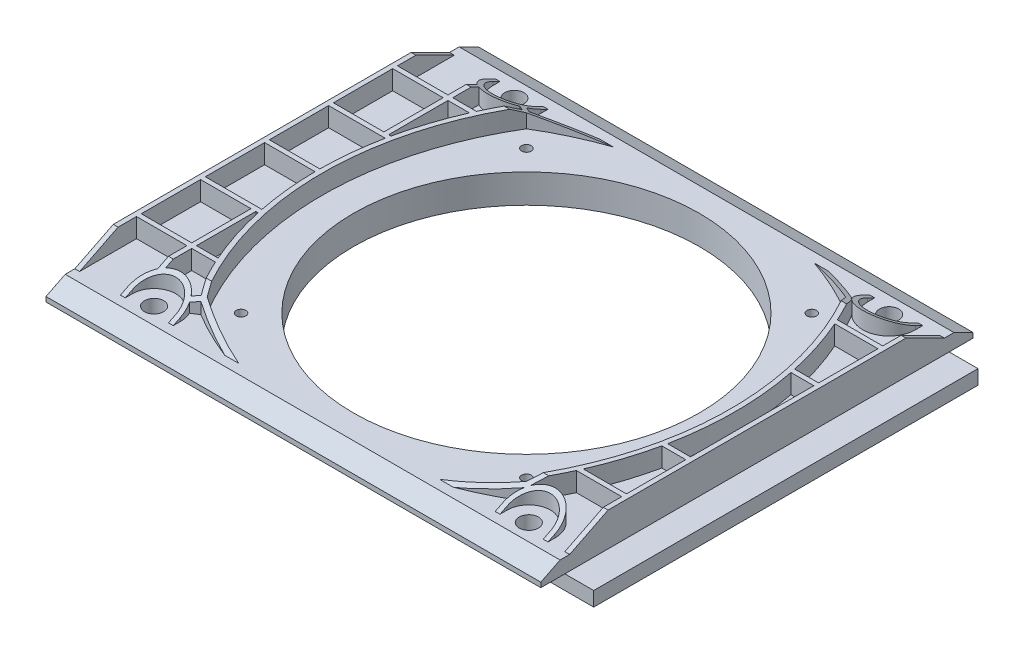
from build123d import *

# Parameters (mm, degrees)
SKETCH1_W               = 103
SKETCH1_H               = 90
BOSS_EXTRUDE1_DEPTH     = 3
SKETCH10_W              = 102
SKETCH10_H              = 80
BOSS_EXTRUDE4_DEPTH     = 3
CUT_EXTRUDE1_REACH      = 75.262
SKETCH2_R               = 36
CUT_EXTRUDE2_REACH      = 75.262
SKETCH3_R               = 2
CUT_EXTRUDE3_REACH      = 75.262
SKETCH5_R               = 1
EXTRUDE_THIN1_OUTLINE_W = 10.5
EXTRUDE_THIN1_OUTLINE_H = 12.333333334
EXTRUDE_THIN1_DEPTH     = 4
CUT_EXTRUDE5_DEPTH      = 113.618826135
SKETCH11_W              = 61
SKETCH11_H              = 3
SKETCH11_W_2            = 94.502012864
SKETCH11_H_2            = 69
CUT_EXTRUDE6_DEPTH      = 3
BOSS_EXTRUDE5_DEPTH     = 69
SKETCH13_R              = 37.5
SKETCH13_R_2            = 36
BOSS_EXTRUDE6_DEPTH     = 3
EXTRUDE_THIN11_DEPTH    = 3
EXTRUDE_THIN11_2_DEPTH  = 3
EXTRUDE_THIN11_3_DEPTH  = 3
EXTRUDE_THIN11_4_DEPTH  = 3
SKETCH14_W              = 11
SKETCH14_H              = 3
EXTRUDE_THIN11_5_DEPTH  = 3
SKETCH14_W_2            = 12
EXTRUDE_THIN11_6_DEPTH  = 3
SKETCH15_R              = 1
CUT_EXTRUDE7_DEPTH      = 74.261517866


# Read off the part's stored shape, not the designer's step: Extrude-Thin1
with BuildPart() as part:
    # Sketch1 → Boss-Extrude1 (new body)
    with BuildSketch(Plane(origin=(0, 0, 0), x_dir=(1, 0, 0), z_dir=(0, 1, 0))):
        Rectangle(SKETCH1_W, SKETCH1_H)
    extrude(amount=BOSS_EXTRUDE1_DEPTH)

    # Sketch10 → Boss-Extrude4 (add)
    with BuildSketch(Plane(origin=(0, 0, 0), x_dir=(-1, 0, 0), z_dir=(0, -1, 0))):
        with Locations((-6.5, 0)):
            Rectangle(SKETCH10_W, SKETCH10_H)
    extrude(amount=BOSS_EXTRUDE4_DEPTH)

    # Sketch2 → Cut-Extrude1 (cut, up to next)
    with BuildSketch(Plane(origin=(0, 3, 0), x_dir=(1, 0, 0), z_dir=(0, 1, 0)), mode=Mode.PRIVATE) as cut_extrude1_sk1:
        with Locations(Location((3.5, 0, 0), (0, 0, 270))):
            Circle(SKETCH2_R)
    cut_extrude1_tool1 = extrude(cut_extrude1_sk1.sketch, amount=-CUT_EXTRUDE1_REACH, mode=Mode.PRIVATE) & part.part
    add(cut_extrude1_tool1.solids().sort_by_distance((3.5, 3, 0))[0], mode=Mode.SUBTRACT)

    # Sketch3 → Cut-Extrude2 (cut, up to next)
    with BuildSketch(Plane(origin=(0, 3, 0), x_dir=(1, 0, 0), z_dir=(0, 1, 0)), mode=Mode.PRIVATE) as cut_extrude2_sk1:
        with Locations(Location((-36.5, 37.5, 0), (0, 0, 270))):
            Circle(SKETCH3_R)
    cut_extrude2_tool1 = extrude(cut_extrude2_sk1.sketch, amount=-CUT_EXTRUDE2_REACH, mode=Mode.PRIVATE) & part.part
    # Sketch3 → Cut-Extrude2 (cut, up to next)
    with BuildSketch(Plane(origin=(0, 3, 0), x_dir=(1, 0, 0), z_dir=(0, 1, 0)), mode=Mode.PRIVATE) as cut_extrude2_sk2:
        with Locations(Location((41.5, 37.5, 0), (0, 0, 270))):
            Circle(SKETCH3_R)
    cut_extrude2_tool2 = extrude(cut_extrude2_sk2.sketch, amount=-CUT_EXTRUDE2_REACH, mode=Mode.PRIVATE) & part.part
    # Sketch3 → Cut-Extrude2 (cut, up to next)
    with BuildSketch(Plane(origin=(0, 3, 0), x_dir=(1, 0, 0), z_dir=(0, 1, 0)), mode=Mode.PRIVATE) as cut_extrude2_sk3:
        with Locations(Location((41.5, -37.5, 0), (0, 0, 270))):
            Circle(SKETCH3_R)
    cut_extrude2_tool3 = extrude(cut_extrude2_sk3.sketch, amount=-CUT_EXTRUDE2_REACH, mode=Mode.PRIVATE) & part.part
    # Sketch3 → Cut-Extrude2 (cut, up to next)
    with BuildSketch(Plane(origin=(0, 3, 0), x_dir=(1, 0, 0), z_dir=(0, 1, 0)), mode=Mode.PRIVATE) as cut_extrude2_sk4:
        with Locations(Location((-36.5, -37.5, 0), (0, 0, 270))):
            Circle(SKETCH3_R)
    cut_extrude2_tool4 = extrude(cut_extrude2_sk4.sketch, amount=-CUT_EXTRUDE2_REACH, mode=Mode.PRIVATE) & part.part
    add(cut_extrude2_tool1.solids().sort_by_distance((-36.5, 3, -37.5))[0], mode=Mode.SUBTRACT)
    add(cut_extrude2_tool2.solids().sort_by_distance((41.5, 3, -37.5))[0], mode=Mode.SUBTRACT)
    add(cut_extrude2_tool3.solids().sort_by_distance((41.5, 3, 37.5))[0], mode=Mode.SUBTRACT)
    add(cut_extrude2_tool4.solids().sort_by_distance((-36.5, 3, 37.5))[0], mode=Mode.SUBTRACT)

    # Sketch5 → Cut-Extrude3 (cut, up to next)
    with BuildSketch(Plane(origin=(0, 3, 0), x_dir=(1, 0, 0), z_dir=(0, 1, 0)), mode=Mode.PRIVATE) as cut_extrude3_sk1:
        with Locations(Location((-26.2, 29.7, 0), (0, 0, 270))):
            Circle(SKETCH5_R)
    cut_extrude3_tool1 = extrude(cut_extrude3_sk1.sketch, amount=-CUT_EXTRUDE3_REACH, mode=Mode.PRIVATE) & part.part
    # Sketch5 → Cut-Extrude3 (cut, up to next)
    with BuildSketch(Plane(origin=(0, 3, 0), x_dir=(1, 0, 0), z_dir=(0, 1, 0)), mode=Mode.PRIVATE) as cut_extrude3_sk2:
        with Locations(Location((33.2, 29.7, 0), (0, 0, 270))):
            Circle(SKETCH5_R)
    cut_extrude3_tool2 = extrude(cut_extrude3_sk2.sketch, amount=-CUT_EXTRUDE3_REACH, mode=Mode.PRIVATE) & part.part
    # Sketch5 → Cut-Extrude3 (cut, up to next)
    with BuildSketch(Plane(origin=(0, 3, 0), x_dir=(1, 0, 0), z_dir=(0, 1, 0)), mode=Mode.PRIVATE) as cut_extrude3_sk3:
        with Locations(Location((33.2, -29.7, 0), (0, 0, 270))):
            Circle(SKETCH5_R)
    cut_extrude3_tool3 = extrude(cut_extrude3_sk3.sketch, amount=-CUT_EXTRUDE3_REACH, mode=Mode.PRIVATE) & part.part
    # Sketch5 → Cut-Extrude3 (cut, up to next)
    with BuildSketch(Plane(origin=(0, 3, 0), x_dir=(1, 0, 0), z_dir=(0, 1, 0)), mode=Mode.PRIVATE) as cut_extrude3_sk4:
        with Locations(Location((-26.2, -29.7, 0), (0, 0, 270))):
            Circle(SKETCH5_R)
    cut_extrude3_tool4 = extrude(cut_extrude3_sk4.sketch, amount=-CUT_EXTRUDE3_REACH, mode=Mode.PRIVATE) & part.part
    add(cut_extrude3_tool1.solids().sort_by_distance((-26.2, 3, -29.7))[0], mode=Mode.SUBTRACT)
    add(cut_extrude3_tool2.solids().sort_by_distance((33.2, 3, -29.7))[0], mode=Mode.SUBTRACT)
    add(cut_extrude3_tool3.solids().sort_by_distance((33.2, 3, 29.7))[0], mode=Mode.SUBTRACT)
    add(cut_extrude3_tool4.solids().sort_by_distance((-26.2, 3, 29.7))[0], mode=Mode.SUBTRACT)

    # Extrude-Thin1 outline → Extrude-Thin1 (add)
    with BuildSketch(Plane(origin=(0, 3, 0), x_dir=(1, 0, 0), z_dir=(0, 1, 0))):
        with BuildLine():
            Line((-51.5, 40.5), (-51.5, -40.5))
            Line((-51.5, -40.5), (-41, -40.5))
            Line((-41, -40.5), (-41, -37.5))
            ThreePointArc((-41, -37.5), (-36.5, -33), (-32, -37.5))
            Line((-32, -37.5), (-32, -40.5))
            Line((-32, -40.5), (37, -40.5))
            Line((37, -40.5), (37, -37.5))
            ThreePointArc((37, -37.5), (41.5, -33), (46, -37.5))
            Line((46, -37.5), (46, -40.5))
            Line((46, -40.5), (51.5, -40.5))
            Line((51.5, -40.5), (51.5, 40.5))
            Line((51.5, 40.5), (46, 40.5))
            Line((46, 40.5), (46, 37.5))
            ThreePointArc((46, 37.5), (41.5, 33), (37, 37.5))
            Line((37, 37.5), (37, 40.5))
            Line((37, 40.5), (-32, 40.5))
            Line((-32, 40.5), (-32, 37.5))
            ThreePointArc((-32, 37.5), (-36.5, 33), (-41, 37.5))
            Line((-41, 37.5), (-41, 40.5))
            Line((-41, 40.5), (-51.5, 40.5))
        make_face()
        with BuildLine():
            Line((-50.5, -27.166666667), (-40, -27.166666667))
            Line((-40, -27.166666667), (-40, -33.257359313))
            ThreePointArc((-40, -33.257359313), (-41.474937186, -35.15479212), (-42, -37.5))
            Line((-42, -37.5), (-42, -39.5))
            Line((-42, -39.5), (-50.5, -39.5))
            Line((-50.5, -39.5), (-50.5, -27.166666667))
        make_face(mode=Mode.SUBTRACT)
        with BuildLine():
            ThreePointArc((-34.064021992, -27.166666667), (-32.503173696, -30.337907716), (-30.772596167, -33.419809501))
            Line((-30.772596167, -33.419809501), (-32.084767986, -34.220407607))
            ThreePointArc((-32.084767986, -34.220407607), (-35.245953727, -32.14487461), (-39, -32.601020514))
            Line((-39, -32.601020514), (-39, -27.166666667))
            Line((-39, -27.166666667), (-34.064021992, -27.166666667))
        make_face(mode=Mode.SUBTRACT)
        with BuildLine():
            ThreePointArc((-30.086481626, -34.172624522), (-24.656391553, -37.099728456), (-18.973741453, -39.5))
            Line((-18.973741453, -39.5), (-31, -39.5))
            Line((-31, -39.5), (-31, -37.5))
            ThreePointArc((-31, -37.5), (-31.142836404, -36.254689515), (-31.56392662, -35.074061092))
            Line((-31.56392662, -35.074061092), (-30.086481626, -34.172624522))
        make_face(mode=Mode.SUBTRACT)
        with Locations((-45.25, -20)):
            Rectangle(EXTRUDE_THIN1_OUTLINE_W, EXTRUDE_THIN1_OUTLINE_H, mode=Mode.SUBTRACT)
        with BuildLine():
            ThreePointArc((-38.514061642, -13.833333333), (-36.82108914, -20.099814555), (-34.512789281, -26.166666667))
            Line((-34.512789281, -26.166666667), (-39, -26.166666667))
            Line((-39, -26.166666667), (-39, -13.833333333))
            Line((-39, -13.833333333), (-38.514061642, -13.833333333))
        make_face(mode=Mode.SUBTRACT)
        with BuildLine():
            ThreePointArc((-39.99808084, -0.5), (-39.65478707, -6.697071885), (-38.723204539, -12.833333333))
            Line((-38.723204539, -12.833333333), (-50.5, -12.833333333))
            Line((-50.5, -12.833333333), (-50.5, -0.5))
            Line((-50.5, -0.5), (-39.99808084, -0.5))
        make_face(mode=Mode.SUBTRACT)
        with BuildLine():
            ThreePointArc((25.973741453, -39.5), (31.689836851, -37.083683283), (37.150025464, -34.134331933))
            ThreePointArc((37.150025464, -34.134331933), (36.295441424, -35.721638387), (36, -37.5))
            Line((36, -37.5), (36, -39.5))
            Line((36, -39.5), (25.973741453, -39.5))
        make_face(mode=Mode.SUBTRACT)
        with BuildLine():
            Line((41.064021992, -27.166666667), (50.5, -27.166666667))
            Line((50.5, -27.166666667), (50.5, -39.5))
            Line((50.5, -39.5), (47, -39.5))
            Line((47, -39.5), (47, -37.5))
            ThreePointArc((47, -37.5), (43.677337851, -32.449336689), (37.723927315, -33.501090764))
            ThreePointArc((37.723927315, -33.501090764), (39.481094932, -30.37981659), (41.064021992, -27.166666667))
        make_face(mode=Mode.SUBTRACT)
        with BuildLine():
            Line((50.5, -13.833333333), (50.5, -26.166666667))
            Line((50.5, -26.166666667), (41.512789281, -26.166666667))
            ThreePointArc((41.512789281, -26.166666667), (43.82108914, -20.099814555), (45.514061642, -13.833333333))
            Line((45.514061642, -13.833333333), (50.5, -13.833333333))
        make_face(mode=Mode.SUBTRACT)
        with BuildLine():
            ThreePointArc((-38.723204539, 12.833333333), (-39.65478707, 6.697071885), (-39.99808084, 0.5))
            Line((-39.99808084, 0.5), (-50.5, 0.5))
            Line((-50.5, 0.5), (-50.5, 12.833333333))
            Line((-50.5, 12.833333333), (-38.723204539, 12.833333333))
        make_face(mode=Mode.SUBTRACT)
        with Locations((-45.25, 20)):
            Rectangle(EXTRUDE_THIN1_OUTLINE_W, EXTRUDE_THIN1_OUTLINE_H, mode=Mode.SUBTRACT)
        with BuildLine():
            ThreePointArc((-34.512789281, 26.166666667), (-36.82108914, 20.099814555), (-38.514061642, 13.833333333))
            Line((-38.514061642, 13.833333333), (-39, 13.833333333))
            Line((-39, 13.833333333), (-39, 26.166666667))
            Line((-39, 26.166666667), (-34.512789281, 26.166666667))
        make_face(mode=Mode.SUBTRACT)
        with BuildLine():
            Line((-40, 33.257359313), (-40, 27.166666667))
            Line((-40, 27.166666667), (-50.5, 27.166666667))
            Line((-50.5, 27.166666667), (-50.5, 39.5))
            Line((-50.5, 39.5), (-42, 39.5))
            Line((-42, 39.5), (-42, 37.5))
            ThreePointArc((-42, 37.5), (-41.474937186, 35.15479212), (-40, 33.257359313))
        make_face(mode=Mode.SUBTRACT)
        with BuildLine():
            ThreePointArc((-30.772596167, 33.419809501), (-32.503173696, 30.337907716), (-34.064021992, 27.166666667))
            Line((-34.064021992, 27.166666667), (-39, 27.166666667))
            Line((-39, 27.166666667), (-39, 32.601020514))
            ThreePointArc((-39, 32.601020514), (-35.245953727, 32.14487461), (-32.084767986, 34.220407607))
            Line((-32.084767986, 34.220407607), (-30.772596167, 33.419809501))
        make_face(mode=Mode.SUBTRACT)
        with BuildLine():
            ThreePointArc((-31.56392662, 35.074061092), (-31.142836404, 36.254689515), (-31, 37.5))
            Line((-31, 37.5), (-31, 39.5))
            Line((-31, 39.5), (-18.973741453, 39.5))
            ThreePointArc((-18.973741453, 39.5), (-24.656391553, 37.099728456), (-30.086481626, 34.172624522))
            Line((-30.086481626, 34.172624522), (-31.56392662, 35.074061092))
        make_face(mode=Mode.SUBTRACT)
        with BuildLine():
            Line((22.885607836, -39.5), (-15.885607836, -39.5))
            ThreePointArc((-15.885607836, -39.5), (-22.991137916, -36.773065937), (-29.72359575, -33.22359575))
            ThreePointArc((-29.72359575, -33.22359575), (-39, 0), (-29.72359575, 33.22359575))
            ThreePointArc((-29.72359575, 33.22359575), (-22.991137916, 36.773065937), (-15.885607836, 39.5))
            Line((-15.885607836, 39.5), (22.885607836, 39.5))
            ThreePointArc((22.885607836, 39.5), (29.991137916, 36.773065937), (36.72359575, 33.22359575))
            ThreePointArc((36.72359575, 33.22359575), (46, 0), (36.72359575, -33.22359575))
            ThreePointArc((36.72359575, -33.22359575), (29.991137916, -36.773065937), (22.885607836, -39.5))
        make_face(mode=Mode.SUBTRACT)
        with BuildLine():
            Line((50.5, 12.833333333), (50.5, -12.833333333))
            Line((50.5, -12.833333333), (45.723204539, -12.833333333))
            ThreePointArc((45.723204539, -12.833333333), (47, 0), (45.723204539, 12.833333333))
            Line((45.723204539, 12.833333333), (50.5, 12.833333333))
        make_face(mode=Mode.SUBTRACT)
        with BuildLine():
            Line((41.512789281, 26.166666667), (50.5, 26.166666667))
            Line((50.5, 26.166666667), (50.5, 13.833333333))
            Line((50.5, 13.833333333), (45.514061642, 13.833333333))
            ThreePointArc((45.514061642, 13.833333333), (43.82108914, 20.099814555), (41.512789281, 26.166666667))
        make_face(mode=Mode.SUBTRACT)
        with BuildLine():
            Line((37.432818498, 33.79756369), (37.087572106, 33.587572106))
            Line((37.087572106, 33.587572106), (37.304289591, 33.943876526))
            ThreePointArc((37.304289591, 33.943876526), (37.367906397, 33.87015118), (37.432818498, 33.79756369))
        make_face(mode=Mode.SUBTRACT)
        with BuildLine():
            Line((25.973741453, 39.5), (36, 39.5))
            Line((36, 39.5), (36, 37.5))
            ThreePointArc((36, 37.5), (36.295441424, 35.721638387), (37.150025464, 34.134331933))
            ThreePointArc((37.150025464, 34.134331933), (31.689836851, 37.083683283), (25.973741453, 39.5))
        make_face(mode=Mode.SUBTRACT)
        with BuildLine():
            Line((50.5, 39.5), (50.5, 27.166666667))
            Line((50.5, 27.166666667), (41.064021992, 27.166666667))
            ThreePointArc((41.064021992, 27.166666667), (39.481094932, 30.37981659), (37.723927315, 33.501090764))
            ThreePointArc((37.723927315, 33.501090764), (43.677337851, 32.449336689), (47, 37.5))
            Line((47, 37.5), (47, 39.5))
            Line((47, 39.5), (50.5, 39.5))
        make_face(mode=Mode.SUBTRACT)
    extrude(amount=EXTRUDE_THIN1_DEPTH)

    # Sketch9 → Cut-Extrude5 (cut, through all)
    with BuildSketch(Plane(origin=(51.5, 0, 0), x_dir=(0, 0, -1), z_dir=(1, 0, 0))):
        Polygon((45, 7), (45, 1), (41, 3), (39, 3), (31, 7), align=None)
        Polygon((-45, 1), (-41, 3), (-39, 3), (-31, 7), (-45, 7), align=None)
    extrude(amount=-CUT_EXTRUDE5_DEPTH, mode=Mode.SUBTRACT)

    # Sketch11 → Cut-Extrude6 (cut)
    with BuildSketch(Plane(origin=(0, -3, 0), x_dir=(-1, 0, 0), z_dir=(0, -1, 0))):
        with Locations((-3.5, -38.5)):
            Rectangle(SKETCH11_W, SKETCH11_H)
        with Locations((-3.5, 38.5)):
            Rectangle(SKETCH11_W, SKETCH11_H)
        with Locations((-6.248993568, -0.5)):
            Rectangle(SKETCH11_W_2, SKETCH11_H_2)
    extrude(amount=-CUT_EXTRUDE6_DEPTH, mode=Mode.SUBTRACT)

    # Sketch12 → Boss-Extrude5 (add)
    with BuildSketch(Plane.XY.offset(-34)):
        Polygon((53.5, -3), (50.5, -3), (45.5, 0), (53.5, 0), align=None)
    extrude(amount=BOSS_EXTRUDE5_DEPTH)

    # Sketch13 → Boss-Extrude6 (add)
    with BuildSketch(Plane(origin=(0, 0, 0), x_dir=(-1, 0, 0), z_dir=(0, -1, 0))):
        with Locations((-3.5, 0)):
            Circle(SKETCH13_R)
        with Locations(Location((-3.5, 0, 0), (0, 0, 270))):
            Circle(SKETCH13_R_2, mode=Mode.SUBTRACT)
    extrude(amount=BOSS_EXTRUDE6_DEPTH)


with BuildPart() as body_2:
    # Sketch14 → Extrude-Thin11 (new body)
    with BuildSketch(Plane(origin=(0, 0, 0), x_dir=(-1, 0, 0), z_dir=(0, -1, 0))):
        Polygon((-28.955844123, 27.577164466), (-37.439339828, 36.060660172), (-39.560660172, 33.939339828), (-31.077164466, 25.455844123), align=None)
    extrude(amount=EXTRUDE_THIN11_DEPTH)


with BuildPart() as body_3:
    # Sketch14 → Extrude-Thin11 2 (new body)
    with BuildSketch(Plane(origin=(0, 0, 0), x_dir=(-1, 0, 0), z_dir=(0, -1, 0))):
        Polygon((24.077164466, 25.455844123), (32.560660172, 33.939339828), (30.439339828, 36.060660172), (21.955844123, 27.577164466), align=None)
    extrude(amount=EXTRUDE_THIN11_2_DEPTH)


with BuildPart() as body_4:
    # Sketch14 → Extrude-Thin11 3 (new body)
    with BuildSketch(Plane(origin=(0, 0, 0), x_dir=(-1, 0, 0), z_dir=(0, -1, 0))):
        Polygon((-31.077164466, -25.455844123), (-40.560660172, -34.939339828), (-38.439339828, -37.060660172), (-28.955844123, -27.577164466), align=None)
    extrude(amount=EXTRUDE_THIN11_3_DEPTH)


with BuildPart() as body_5:
    # Sketch14 → Extrude-Thin11 4 (new body)
    with BuildSketch(Plane(origin=(0, 0, 0), x_dir=(-1, 0, 0), z_dir=(0, -1, 0))):
        Polygon((21.955844123, -27.577164466), (31.439339828, -37.060660172), (33.560660172, -34.939339828), (24.077164466, -25.455844123), align=None)
    extrude(amount=EXTRUDE_THIN11_4_DEPTH)


with BuildPart() as body_6:
    # Sketch14 → Extrude-Thin11 5 (new body)
    with BuildSketch(Plane(origin=(0, 0, 0), x_dir=(-1, 0, 0), z_dir=(0, -1, 0))):
        with Locations((-45, 0)):
            Rectangle(SKETCH14_W, SKETCH14_H)
    extrude(amount=EXTRUDE_THIN11_5_DEPTH)


with BuildPart() as body_7:
    # Sketch14 → Extrude-Thin11 6 (new body)
    with BuildSketch(Plane(origin=(0, 0, 0), x_dir=(-1, 0, 0), z_dir=(0, -1, 0))):
        with Locations((38.5, 0)):
            Rectangle(SKETCH14_W_2, SKETCH14_H)
    extrude(amount=EXTRUDE_THIN11_6_DEPTH)


with BuildPart() as cut_extrude7_tool:
    # Sketch15 → Cut-Extrude7 (new, through all)
    with BuildSketch(Plane(origin=(0, 3, 0), x_dir=(1, 0, 0), z_dir=(0, 1, 0))):
        with Locations(Location((-26.2, -29.7, 0), (0, 0, 270))):
            Circle(SKETCH15_R)
        with Locations(Location((-26.2, 29.7, 0), (0, 0, 270))):
            Circle(SKETCH15_R)
        with Locations(Location((33.2, 29.7, 0), (0, 0, 270))):
            Circle(SKETCH15_R)
        with Locations(Location((33.2, -29.7, 0), (0, 0, 270))):
            Circle(SKETCH15_R)
    extrude(amount=-CUT_EXTRUDE7_DEPTH)


with BuildPart() as body_2_1:
    add(body_2.part)

    # Cut-Extrude7: cut by cut_extrude7_tool
    add(cut_extrude7_tool.part, mode=Mode.SUBTRACT)


with BuildPart() as body_3_1:
    add(body_3.part)

    # Cut-Extrude7: cut by cut_extrude7_tool
    add(cut_extrude7_tool.part, mode=Mode.SUBTRACT)


with BuildPart() as body_4_1:
    add(body_4.part)

    # Cut-Extrude7: cut by cut_extrude7_tool
    add(cut_extrude7_tool.part, mode=Mode.SUBTRACT)


with BuildPart() as body_5_1:
    add(body_5.part)

    # Cut-Extrude7: cut by cut_extrude7_tool
    add(cut_extrude7_tool.part, mode=Mode.SUBTRACT)


solid = Compound([part.part, body_6.part, body_7.part, body_2_1.part, body_3_1.part, body_4_1.part, body_5_1.part])
